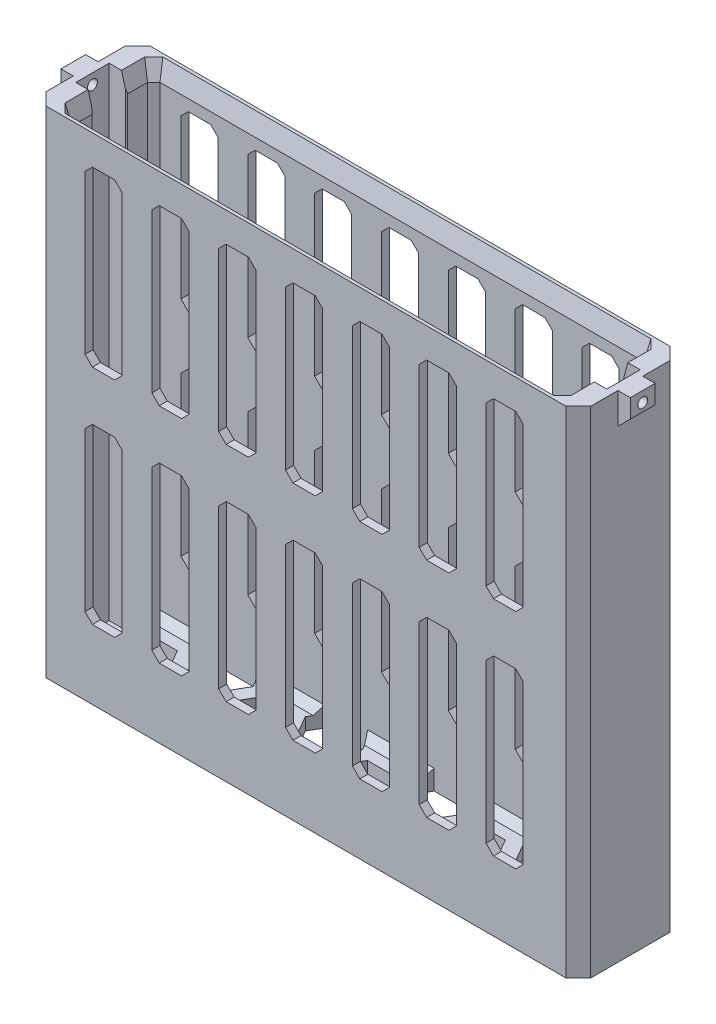
from build123d import *

# Parameters (mm, degrees)
SKETCH1_W                = 220
SKETCH1_H                = 42
BOSS_EXTRUDE1_DEPTH      = 200
CHAMFER1_SIZE            = 0.5
CHAMFER2_SIZE            = 2
CHAMFER2_SIZE2           = 7.464101615
CUT_EXTRUDE1_REACH       = 234.086
LPATTERN1_COUNT          = 7
LPATTERN1_PITCH          = 27
LPATTERN1_COUNT_DIR2     = 2
LPATTERN1_PITCH_DIR2     = 90
SKETCH3_W                = 10
SKETCH3_H                = 12.5
BOSS_EXTRUDE2_DEPTH      = 5
SKETCH4_R                = 2
CUT_EXTRUDE2_DEPTH       = 10
CHAMFER3_SIZE            = 5
CHAMFER3_OF_MIRROR1_SIZE = 5
CHAMFER4_SIZE            = 5
BOSS_EXTRUDE3_DEPTH      = 5
CUT_EXTRUDE3_DEPTH       = 5
LPATTERN2_COUNT          = 4
LPATTERN2_PITCH          = 44.15
CHAMFER5_SIZE            = 3


with BuildPart() as part:
    # Sketch1 → Boss-Extrude1 (new body)
    with BuildSketch(Plane(origin=(0, 0, 0), x_dir=(1, 0, 0), z_dir=(0, 1, 0))):
        Rectangle(SKETCH1_W, SKETCH1_H)
        Polygon((-100.25, -6.75), (-100.25, -15.25), (-97.75, -17.75), (97.75, -17.75), (100.25, -15.25), (100.25, -6.75), (107.25, -6.75), (107.25, 6.75), (100.25, 6.75), (100.25, 15.25), (97.75, 17.75), (-97.75, 17.75), (-100.25, 15.25), (-100.25, 6.75), (-107.25, 6.75), (-107.25, -6.75), align=None, mode=Mode.SUBTRACT)
    extrude(amount=BOSS_EXTRUDE1_DEPTH)

    # Chamfer1
    chamfer1_edges = [part.edges().sort_by_distance(p)[0] for p in [
        (100.25, 100, -6.75),
        (-100.25, 100, -6.75),
        (-100.25, 100, 6.75),
        (100.25, 100, 6.75),
    ]]
    chamfer(chamfer1_edges, length=CHAMFER1_SIZE)

    # Chamfer2
    chamfer2_edges = [part.edges().sort_by_distance(p)[0] for p in [
        (100.25, 200, 11.25),
        (99, 200, 16.5),
        (0, 200, 17.75),
        (-99, 200, 16.5),
        (-100.25, 200, 11.25),
        (100.25, 200, -11.25),
        (99, 200, -16.5),
        (-100.25, 200, -11.25),
        (-99, 200, -16.5),
        (0, 200, -17.75),
    ]]
    chamfer2_side = [part.faces().sort_by_distance(p)[0] for p in [
        (-104, 200, 8.989732127),
    ]]
    chamfer(chamfer2_edges, length=CHAMFER2_SIZE, length2=CHAMFER2_SIZE2, reference=chamfer2_side[0])

    # Cut-Extrude1: up to this face of the body (flat: up to its plane)
    cut_extrude1_end = Plane(part.part.faces().sort_by_distance((0, 100, -21))[0])
    # Sketch2 → Cut-Extrude1 (cut, up to the picked face)
    with BuildSketch(Plane.XY.offset(21), mode=Mode.PRIVATE) as cut_extrude1_sk1:
        Polygon((-89.274598261, 185.023085201), (-86.274598261, 188.023085201), (-77.274598261, 188.023085201), (-74.274598261, 185.023085201), (-74.274598261, 121.023085201), (-77.274598261, 118.023085201), (-86.274598261, 118.023085201), (-89.274598261, 121.023085201), align=None)
    cut_extrude1_tool1 = split(extrude(cut_extrude1_sk1.sketch, amount=-CUT_EXTRUDE1_REACH, mode=Mode.PRIVATE), bisect_by=cut_extrude1_end, keep=Keep.BOTH, mode=Mode.PRIVATE)
    cut_extrude1 = cut_extrude1_tool1.solids().sort_by(Axis((-81.774598, 153.023085, 21), (0, 0, -1)))[0]
    add(cut_extrude1, mode=Mode.SUBTRACT)

    # LPattern1: Cut-Extrude1 7 × 2
    with Locations(*[(i * LPATTERN1_PITCH, -j * LPATTERN1_PITCH_DIR2, 0) for i in range(LPATTERN1_COUNT) for j in range(LPATTERN1_COUNT_DIR2) if (i, j) != (0, 0)]):
        add(cut_extrude1, mode=Mode.SUBTRACT)

    # Sketch3 → Boss-Extrude2 (add)
    with BuildSketch(Plane(origin=(110, 0, 0), x_dir=(0, 0, -1), z_dir=(1, 0, 0))):
        with Locations((0, 193.75)):
            Rectangle(SKETCH3_W, SKETCH3_H)
    boss_extrude2 = extrude(amount=BOSS_EXTRUDE2_DEPTH)

    # Sketch4 → Cut-Extrude2 (cut)
    with BuildSketch(Plane(origin=(115, 0, 0), x_dir=(0, 0, -1), z_dir=(1, 0, 0))):
        with Locations((0, 195.783109642)):
            Circle(SKETCH4_R)
    cut_extrude2 = extrude(amount=-CUT_EXTRUDE2_DEPTH, mode=Mode.SUBTRACT)

    # Chamfer3
    chamfer3_edges = [part.edges().sort_by_distance(p)[0] for p in [
        (115, 187.5, 0),
    ]]
    chamfer(chamfer3_edges, length=CHAMFER3_SIZE - 0.0001)  # a hair under: the kernel refuses the full size

    # Mirror1: Boss-Extrude2, Cut-Extrude2 across plane
    add(boss_extrude2.mirror(Plane(origin=(0, 0, 0), x_dir=(0, 0, 1), z_dir=(1, 0, 0))))
    add(cut_extrude2.mirror(Plane(origin=(0, 0, 0), x_dir=(0, 0, 1), z_dir=(1, 0, 0))), mode=Mode.SUBTRACT)

    # Chamfer3 of Mirror1
    chamfer3_of_mirror1_edges = [part.edges().sort_by_distance(p)[0] for p in [
        (-115, 187.5, 0),
    ]]
    chamfer(chamfer3_of_mirror1_edges, length=CHAMFER3_OF_MIRROR1_SIZE - 0.0001)  # a hair under: the kernel refuses the full size

    # Chamfer4
    chamfer4_edges = [part.edges().sort_by_distance(p)[0] for p in [
        (-110, 100, -21),
        (110, 100, -21),
        (110, 100, 21),
        (-110, 100, 21),
    ]]
    chamfer(chamfer4_edges, length=CHAMFER4_SIZE)

    # Sketch5 → Boss-Extrude3 (add)
    with BuildSketch(Plane.XZ):
        Polygon((110, -16), (110, 16), (105, 21), (-105, 21), (-110, 16), (-110, -16), (-105, -21), (105, -21), align=None)
    extrude(amount=-BOSS_EXTRUDE3_DEPTH)

    # Sketch7 → Cut-Extrude3 (cut)
    with BuildSketch(Plane(origin=(0, 5, 0), x_dir=(1, 0, 0), z_dir=(0, 1, 0))):
        Polygon((-55.105337777, 12.75), (-57.992089123, 17.75), (-75.312597198, 17.75), (-78.199348544, 12.75), (-72.425845852, 2.75), (-60.878840468, 2.75), align=None)
        Polygon((-77.188985573, 0), (-82.962488265, 10), (-94.509493649, 10), (-100.282996341, 0), (-94.509493649, -10), (-82.962488265, -10), align=None)
        Polygon((-33.02168998, 0), (-38.795192672, 10), (-50.342198056, 10), (-56.115700748, 0), (-50.342198056, -10), (-38.795192672, -10), align=None)
        Polygon((-55.105337777, -12.75), (-60.878840468, -2.75), (-72.425845852, -2.75), (-78.199348544, -12.75), (-75.312597198, -17.75), (-57.992089123, -17.75), align=None)
    cut_extrude3 = extrude(amount=-CUT_EXTRUDE3_DEPTH, mode=Mode.SUBTRACT)

    # LPattern2: Cut-Extrude3 ×4
    with Locations(*[(i * LPATTERN2_PITCH, 0, 0) for i in range(1, LPATTERN2_COUNT)]):
        add(cut_extrude3, mode=Mode.SUBTRACT)

    # Chamfer5
    chamfer5_edges = [part.edges().sort_by_distance(p)[0] for p in [
        (86.103955439, 5, 17.75),
        (86.103955439, 5, -17.75),
        (43.72265684, 5, -17.75),
        (43.72265684, 5, 17.75),
        (-0.42734316, 5, 17.75),
        (-44.57734316, 5, 17.75),
        (-86.531298599, 5, 17.75),
        (-86.531298599, 5, -17.75),
        (-0.42734316, 5, -17.75),
        (-44.57734316, 5, -17.75),
    ]]
    chamfer(chamfer5_edges, length=CHAMFER5_SIZE)


solid = part.part
